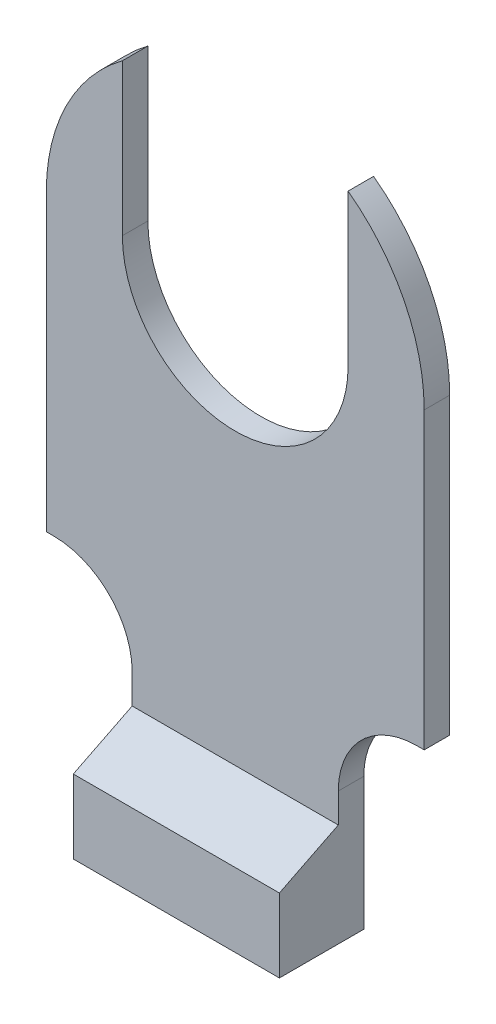
from build123d import *

# Parameters (mm, degrees)
EXTRUDE_1_DEPTH     = 1.04
CUT_EXTRUDE_1_DEPTH = 1.04
SKETCH_4_W          = 8.4
SKETCH_4_H          = 3
EXTRUDE_2_DEPTH     = 2.4
CHAMFER_1_SIZE      = 1.2
CHAMFER_1_SIZE_2    = 2.4


with BuildPart() as part:
    # Эскиз1 → Бобышка-Вытянуть1 (new body)
    with BuildSketch(Plane.XY):
        with BuildLine():
            Line((-4.6, 0), (-4.6, 6.174949393))
            ThreePointArc((-4.6, 6.174949393), (-6.88149693, 3.454706934), (-7.7, 0))
            Line((-7.7, 0), (-7.7, -20.6))
            Line((-7.7, -20.6), (7.7, -20.6))
            Line((7.7, -20.6), (7.7, 0))
            ThreePointArc((7.7, 0), (6.88149693, 3.454706934), (4.6, 6.174949393))
            Line((4.6, 6.174949393), (4.6, 0))
            ThreePointArc((4.6, 0), (0, -4.6), (-4.6, 0))
        make_face()
    extrude(amount=EXTRUDE_1_DEPTH)

    # Эскиз3 → Вырез-Вытянуть1 (cut)
    with BuildSketch(Plane.XY.offset(1.04)):
        with BuildLine():
            Line((-7.7, -20.6), (-4.2, -20.6))
            Line((-4.2, -20.6), (-4.2, -15.2))
            ThreePointArc((-4.2, -15.2), (-5.1372583, -12.9372583), (-7.4, -12))
            Line((-7.4, -12), (-7.7, -12))
            Line((-7.7, -12), (-7.7, -20.6))
        make_face()
        with BuildLine():
            Line((4.2, -20.6), (4.2, -15.2))
            ThreePointArc((4.2, -15.2), (5.1372583, -12.9372583), (7.4, -12))
            Line((7.4, -12), (7.7, -12))
            Line((7.7, -12), (7.7, -20.6))
            Line((7.7, -20.6), (4.2, -20.6))
        make_face()
    extrude(amount=-CUT_EXTRUDE_1_DEPTH, mode=Mode.SUBTRACT)

    # Эскиз4 → Бобышка-Вытянуть2 (add)
    with BuildSketch(Plane.XY.offset(1.04)):
        with Locations((0, -19.1)):
            Rectangle(SKETCH_4_W, SKETCH_4_H)
    extrude(amount=EXTRUDE_2_DEPTH)

    # Фаска1
    # the kernel refuses this chamfer: 2.4, 1.2 mm, written as the material it adds along each edge
    with BuildSketch(Plane(origin=(4.2, -17.6, 1.04), x_dir=(0, 0.9976223042390325, -0.06891834360170876), z_dir=(-1, 0, 0))) as chamfer_1_piece_1_section:
        Polygon((CHAMFER_1_SIZE * 0.997622304239, -CHAMFER_1_SIZE * 0.0689183436017), (-CHAMFER_1_SIZE_2 * 0.0689183436017, -CHAMFER_1_SIZE_2 * 0.997622304239), (0, 0), align=None)
    chamfer_1_piece_1 = extrude(amount=8.4, mode=Mode.PRIVATE)
    chamfer_1_piece_1 = split(chamfer_1_piece_1, bisect_by=Plane(origin=(0, -17.217816218, 3.44), z_dir=(0, 0, -1)), keep=Keep.TOP, mode=Mode.PRIVATE)
    add(chamfer_1_piece_1)


solid = part.part
